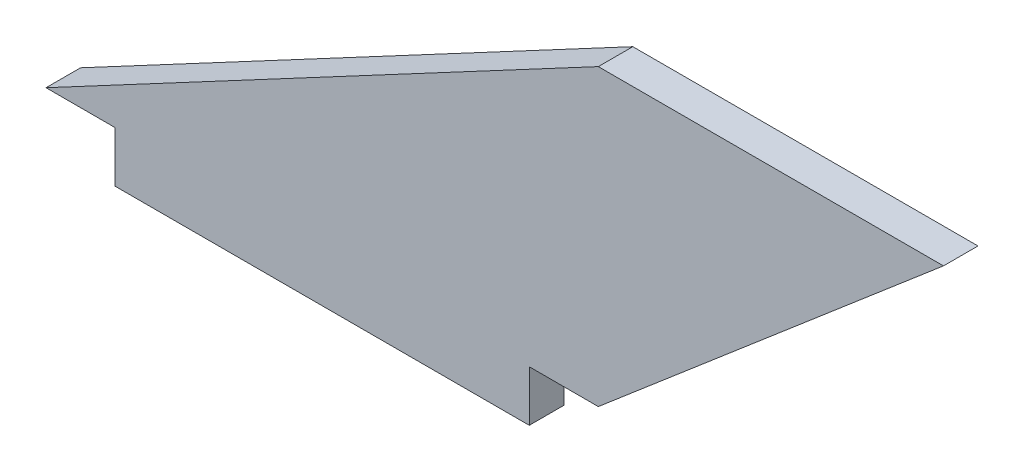
from build123d import *

# Parameters (mm, degrees)
BOSS_EXTRUDE1_DEPTH = 5


with BuildPart() as part:
    # Sketch1 → Boss-Extrude1 (new body)
    with BuildSketch(Plane.XY):
        Polygon((0, 0), (0, -7.350993377), (60, -7.350993377), (60, 0), (70, 0), (120, 42.649006623), (70, 42.649006623), (-10, 0), align=None)
    extrude(amount=BOSS_EXTRUDE1_DEPTH)


solid = part.part
